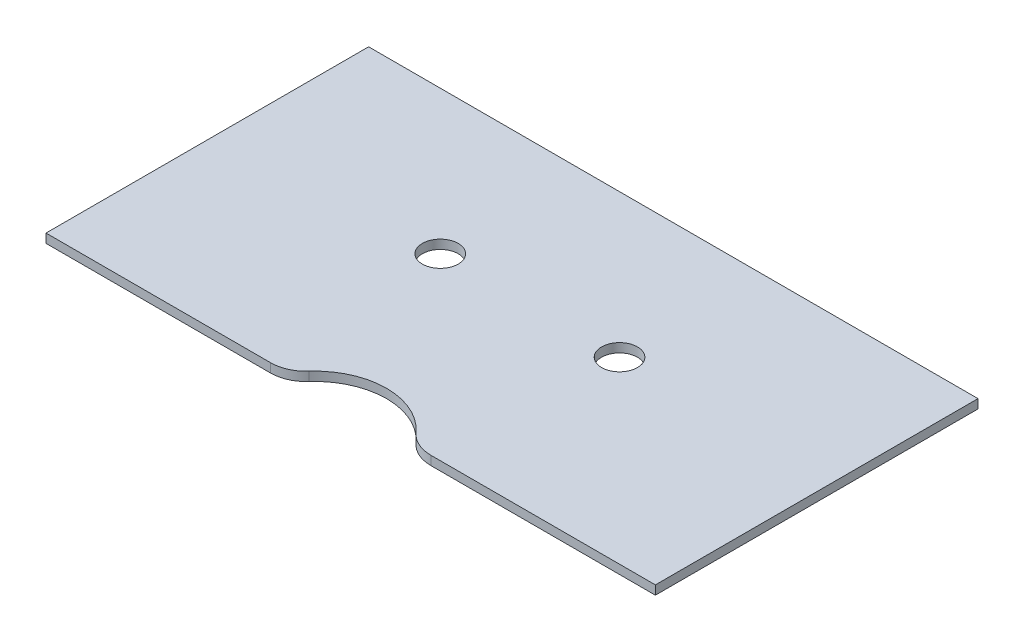
from build123d import *

# Parameters (mm, degrees)
BOSS_EXTRUDE1_DEPTH = 3.175
SKETCH2_R           = 6.35
CUT_EXTRUDE1_DEPTH  = 334.375
FILLET1_R           = 12.7


with BuildPart() as part:
    # Sketch1 → Boss-Extrude1 (new body)
    with BuildSketch(Plane(origin=(0, 0, 0), x_dir=(1, 0, 0), z_dir=(0, 1, 0))):
        with BuildLine():
            Line((0, 254), (0, 139.7))
            Line((0, 139.7), (85.952954744, 139.7))
            ThreePointArc((85.952954744, 139.7), (107.95, 152.4), (129.947045256, 139.7))
            Line((129.947045256, 139.7), (215.9, 139.7))
            Line((215.9, 139.7), (215.9, 254))
            Line((215.9, 254), (0, 254))
        make_face()
    extrude(amount=BOSS_EXTRUDE1_DEPTH)

    # Sketch2 → Cut-Extrude1 (cut, through all)
    with BuildSketch(Plane(origin=(0, 3.175, 0), x_dir=(1, 0, 0), z_dir=(0, 1, 0))):
        with Locations((76.2, 203.2)):
            Circle(SKETCH2_R)
        with Locations((139.7, 203.2)):
            Circle(SKETCH2_R)
    extrude(amount=-CUT_EXTRUDE1_DEPTH, mode=Mode.SUBTRACT)

    # Fillet1
    fillet1_edges = [part.edges().sort_by_distance(p)[0] for p in [
        (129.947045256, 1.5875, -139.7),
        (85.952954744, 1.5875, -139.7),
    ]]
    fillet(fillet1_edges, radius=FILLET1_R)


solid = part.part
